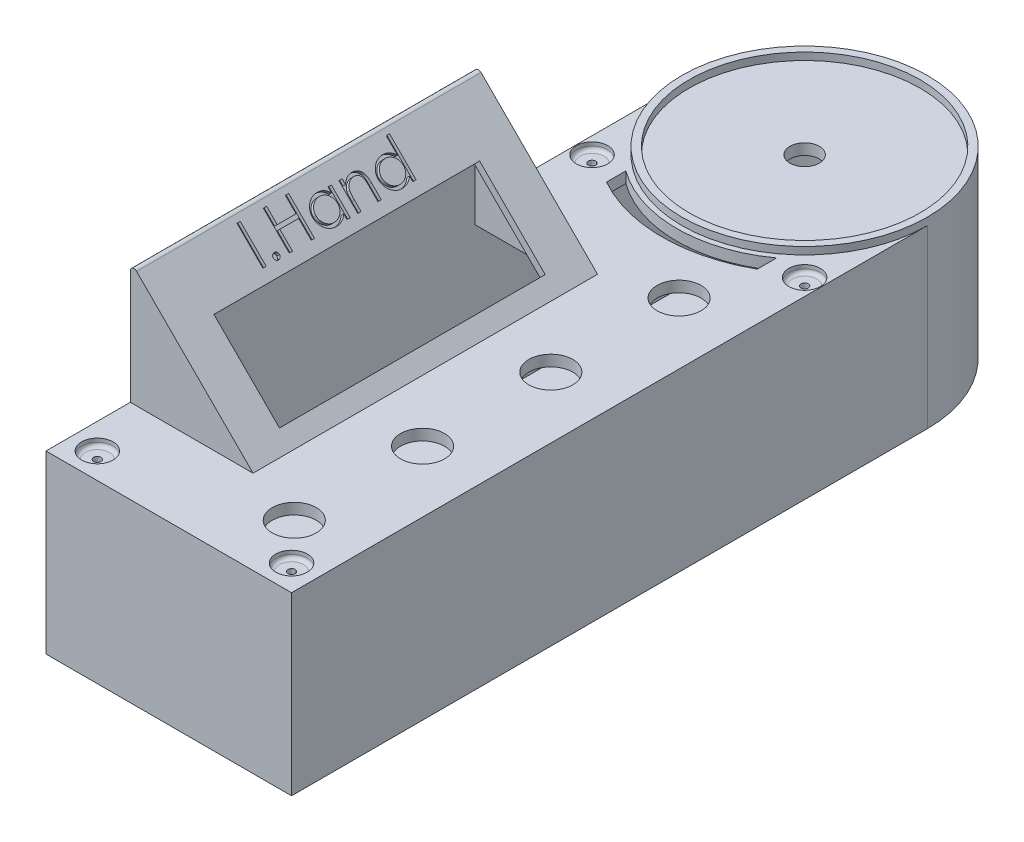
from build123d import *

# Parameters (mm, degrees)
SKETCH4_W                = 63
SKETCH4_H                = 43
BOSS_EXTRUDE2_DEPTH      = 173.5
SKETCH6_R                = 4
CUT_EXTRUDE1_DEPTH       = 3
SKETCH9_W                = 63
SKETCH9_H                = 43
CUT_EXTRUDE2_DEPTH       = 173.5
SKETCH10_R               = 8.2
BOSS_EXTRUDE3_DEPTH      = 22.8
SKETCH11_W               = 63
SKETCH11_H               = 43
BOSS_EXTRUDE4_DEPTH      = 2
SKETCH13_R               = 3
BOSS_EXTRUDE5_DEPTH      = 43
SKETCH14_R               = 1
CUT_EXTRUDE3_DEPTH       = 46
SKETCH15_R               = 4.3
CUT_EXTRUDE4_DEPTH       = 2
FILLET1_R                = 1
SKETCH19_R               = 6
CUT_EXTRUDE5_DEPTH       = 3
BOSS_EXTRUDE6_DEPTH      = 94
SKETCH21_W               = 26.671572875
SKETCH21_H               = 94
CUT_EXTRUDE6_DEPTH       = 13
FILLET2_R                = 1
BOSS_EXTRUDE8_DEPTH      = 2
SKETCH23_W               = 72.5
SKETCH23_H               = 25.3
CUT_EXTRUDE7_DEPTH       = 2
BOSS_EXTRUDE9_START      = -2
BOSS_EXTRUDE9_DEPTH      = 2
SKETCH25_R               = 3
BOSS_EXTRUDE10_DEPTH     = 48
SKETCH26_R               = 1
CUT_EXTRUDE8_DEPTH       = 46
SKETCH27_R               = 4.3
CUT_EXTRUDE9_DEPTH       = 2
FILLET3_R                = 1
SKETCH30_W               = 56
SKETCH30_H               = 18
CUT_EXTRUDE10_DEPTH      = 2
SKETCH31_W               = 60
SKETCH31_H               = 22
SKETCH31_W_2             = 56
SKETCH31_H_2             = 18
BOSS_EXTRUDE11_DEPTH     = 12
FILLET4_R                = 1
SKETCH33_W               = 56
SKETCH33_H               = 18
BOSS_EXTRUDE12_DEPTH     = 2
SKETCH34_W               = 0.897435897
SKETCH34_H               = 10
CUT_EXTRUDE11_DEPTH      = 1
SKETCH35_W               = 13.1
SKETCH35_H               = 12
SKETCH35_W_2             = 9.9
SKETCH35_H_2             = 11.8
CUT_EXTRUDE12_DEPTH      = 2
FILLET5_R                = 1
CUT_EXTRUDE13_DEPTH      = 186.67848556
CUT_EXTRUDE13_DEPTH_BACK = 3
FILLET6_R                = 1
SKETCH37_W               = 140.841687605
SKETCH37_H               = 2
BOSS_EXTRUDE13_DEPTH     = 4
FILLET8_R                = 2


with BuildPart() as part:
    # Sketch1 → Revolve1 (revolve)
    with BuildSketch(Plane.XY, mode=Mode.PRIVATE) as revolve1_sk:
        Polygon((-31.5, 48), (-31.5, 50), (-33.5, 50), (-33.5, 0), (0, 0), (0, 24.8), (-8.2, 24.8), (-8.2, 2), (-31.5, 2), (-31.5, 45), (-4, 45), (-4, 48), align=None)
    revolve(revolve1_sk.sketch.rotate(Axis((0, 0, 0), (0, 1, 0)), 270), axis=Axis((0, 0, 0), (0, 1, 0)))

    # Sketch4 → Boss-Extrude2 (add)
    with BuildSketch(Plane.XY):
        Polygon((33.5, 0), (-33.5, 0), (-33.5, 48), (-31.5, 48), (31.5, 48), (33.5, 48), align=None)
        with Locations((0, 23.5)):
            Rectangle(SKETCH4_W, SKETCH4_H, mode=Mode.SUBTRACT)
    extrude(amount=BOSS_EXTRUDE2_DEPTH)

    # Sketch6 → Cut-Extrude1 (cut)
    with BuildSketch(Plane(origin=(0, 48, 0), x_dir=(1, 0, 0), z_dir=(0, 1, 0))):
        with Locations(Location((0, 0, 0), (0, 0, 90))):
            Circle(SKETCH6_R)
    extrude(amount=-CUT_EXTRUDE1_DEPTH, mode=Mode.SUBTRACT)

    # Sketch9 → Cut-Extrude2 (cut)
    with BuildSketch(Plane.XY.offset(173.5)):
        with Locations((0, 23.5)):
            Rectangle(SKETCH9_W, SKETCH9_H)
    extrude(amount=-CUT_EXTRUDE2_DEPTH, mode=Mode.SUBTRACT)

    # Sketch10 → Boss-Extrude3 (add)
    with BuildSketch(Plane(origin=(0, 2, 0), x_dir=(1, 0, 0), z_dir=(0, 1, 0))):
        with Locations(Location((0, 0, 0), (0, 0, 90))):
            Circle(SKETCH10_R)
    extrude(amount=BOSS_EXTRUDE3_DEPTH)

    # Sketch11 → Boss-Extrude4 (add)
    with BuildSketch(Plane.XY.offset(173.5)):
        with Locations((0, 23.5)):
            Rectangle(SKETCH11_W, SKETCH11_H)
    extrude(amount=-BOSS_EXTRUDE4_DEPTH)

    # Sketch13 → Boss-Extrude5 (add)
    with BuildSketch(Plane(origin=(0, 2, 0), x_dir=(1, 0, 0), z_dir=(0, 1, 0))):
        with Locations(Location((-26.5, -166.5, 0), (0, 0, 90))):
            Circle(SKETCH13_R)
        with Locations(Location((26.5, -166.5, 0), (0, 0, 90))):
            Circle(SKETCH13_R)
    extrude(amount=BOSS_EXTRUDE5_DEPTH)

    # Sketch14 → Cut-Extrude3 (cut)
    with BuildSketch(Plane(origin=(0, 2, 0), x_dir=(1, 0, 0), z_dir=(0, 1, 0))):
        with Locations(Location((-26.5, -166.5, 0), (0, 0, 270))):
            Circle(SKETCH14_R)
        with Locations(Location((26.5, -166.5, 0), (0, 0, 270))):
            Circle(SKETCH14_R)
    extrude(amount=CUT_EXTRUDE3_DEPTH, mode=Mode.SUBTRACT)

    # Sketch15 → Cut-Extrude4 (cut)
    with BuildSketch(Plane(origin=(0, 48, 0), x_dir=(1, 0, 0), z_dir=(0, 1, 0))):
        with Locations(Location((-26.5, -166.5, 0), (0, 0, 270))):
            Circle(SKETCH15_R)
        with Locations(Location((26.5, -166.5, 0), (0, 0, 270))):
            Circle(SKETCH15_R)
    extrude(amount=-CUT_EXTRUDE4_DEPTH, mode=Mode.SUBTRACT)

    # Fillet1
    fillet1_edges = [part.edges().sort_by_distance(p)[0] for p in [
        (-26.5, 46, 162.2),
        (26.5, 46, 162.2),
    ]]
    fillet(fillet1_edges, radius=FILLET1_R)

    # Sketch19 → Cut-Extrude5 (cut)
    with BuildSketch(Plane(origin=(0, 48, 0), x_dir=(1, 0, 0), z_dir=(0, 1, 0))):
        with Locations(Location((16.75, -51, 0), (0, 0, 270))):
            Circle(SKETCH19_R)
        with Locations(Location((16.75, -86, 0), (0, 0, 270))):
            Circle(SKETCH19_R)
        with Locations(Location((16.75, -121, 0), (0, 0, 270))):
            Circle(SKETCH19_R)
        with Locations(Location((16.75, -156, 0), (0, 0, 270))):
            Circle(SKETCH19_R)
    extrude(amount=-CUT_EXTRUDE5_DEPTH, mode=Mode.SUBTRACT)

    # Sketch20 → Boss-Extrude6 (add)
    with BuildSketch(Plane.XY.offset(56.5)):
        Polygon((0, 48), (-33.5, 81.5), (-33.5, 48), align=None)
        Polygon((-4.828427125, 50), (-31.5, 76.671572875), (-31.5, 50), align=None, mode=Mode.SUBTRACT)
    extrude(amount=BOSS_EXTRUDE6_DEPTH)

    # Sketch21 → Cut-Extrude6 (cut)
    with BuildSketch(Plane(origin=(0, 50, 0), x_dir=(1, 0, 0), z_dir=(0, 1, 0))):
        with Locations((-18.164213563, -103.5)):
            Rectangle(SKETCH21_W, SKETCH21_H)
    extrude(amount=-CUT_EXTRUDE6_DEPTH, mode=Mode.SUBTRACT)

    # Fillet2
    fillet2_edges = [part.edges().sort_by_distance(p)[0] for p in [
        (-33.5, 81.5, 103.5),
        (-31.5, 76.671572875, 103.5),
    ]]
    fillet(fillet2_edges, radius=FILLET2_R)

    # Sketch22 → Boss-Extrude8 (add)
    with BuildSketch(Plane.XY.offset(150.5)):
        with BuildLine():
            Line((-33.5, 48), (-33.5, 46))
            Line((-33.5, 46), (0, 46))
            Line((0, 46), (0, 48))
            Line((0, 48), (-31.792893219, 79.792893219))
            ThreePointArc((-31.792893219, 79.792893219), (-32.882683432, 80.00966597), (-33.5, 79.085786438))
            Line((-33.5, 79.085786438), (-33.5, 48))
        make_face()
    extrude(amount=-BOSS_EXTRUDE8_DEPTH)

    # Sketch23 → Cut-Extrude7 (cut)
    with BuildSketch(Plane(origin=(24, 24, 0), x_dir=(0, 0, -1), z_dir=(0.7071067811865437, 0.7071067811865515, 0))):
        with Locations((-103.5, 51.591125497)):
            Rectangle(SKETCH23_W, SKETCH23_H)
    extrude(amount=-CUT_EXTRUDE7_DEPTH, mode=Mode.SUBTRACT)

    # Sketch24 → Boss-Extrude9 (add)
    with BuildSketch(Plane(origin=(0, 0, 56.5), x_dir=(-1, 0, 0), z_dir=(0, 0, -1)).offset(BOSS_EXTRUDE9_START)):
        with BuildLine():
            Line((4.828427125, 45), (4.828427125, 48))
            Line((4.828427125, 48), (4.828427125, 50))
            Line((4.828427125, 50), (29.792893219, 74.964466094))
            ThreePointArc((29.792893219, 74.964466094), (30.882683432, 75.181238845), (31.5, 74.257359313))
            Line((31.5, 74.257359313), (31.5, 48))
            Line((31.5, 48), (31.5, 45))
            Line((31.5, 45), (4.828427125, 45))
        make_face()
    extrude(amount=BOSS_EXTRUDE9_DEPTH)

    # Sketch25 → Boss-Extrude10 (add)
    with BuildSketch(Plane(origin=(0, 48, 0), x_dir=(1, 0, 0), z_dir=(0, 1, 0))):
        with Locations((29, -29)):
            Circle(SKETCH25_R)
        with Locations((-29, -29)):
            Circle(SKETCH25_R)
    extrude(amount=-BOSS_EXTRUDE10_DEPTH)

    # Sketch26 → Cut-Extrude8 (cut)
    with BuildSketch(Plane(origin=(0, 48, 0), x_dir=(1, 0, 0), z_dir=(0, 1, 0))):
        with Locations(Location((29, -29, 0), (0, 0, 270))):
            Circle(SKETCH26_R)
        with Locations(Location((-29, -29, 0), (0, 0, 270))):
            Circle(SKETCH26_R)
    extrude(amount=-CUT_EXTRUDE8_DEPTH, mode=Mode.SUBTRACT)

    # Sketch27 → Cut-Extrude9 (cut)
    with BuildSketch(Plane(origin=(0, 48, 0), x_dir=(1, 0, 0), z_dir=(0, 1, 0))):
        with Locations(Location((-29, -29, 0), (0, 0, 270))):
            Circle(SKETCH27_R)
        with Locations(Location((29, -29, 0), (0, 0, 270))):
            Circle(SKETCH27_R)
    extrude(amount=-CUT_EXTRUDE9_DEPTH, mode=Mode.SUBTRACT)

    # Fillet3
    fillet3_edges = [part.edges().sort_by_distance(p)[0] for p in [
        (-29, 46, 24.7),
        (29, 46, 24.7),
    ]]
    fillet(fillet3_edges, radius=FILLET3_R)

    # Sketch30 → Cut-Extrude10 (cut)
    with BuildSketch(Plane.ZY.offset(33.5)):
        with Locations((103.5, 11)):
            Rectangle(SKETCH30_W, SKETCH30_H)
    extrude(amount=-CUT_EXTRUDE10_DEPTH, mode=Mode.SUBTRACT)

    # Sketch31 → Boss-Extrude11 (add)
    with BuildSketch(Plane.ZY.offset(33.5)):
        with Locations((103.5, 11)):
            Rectangle(SKETCH31_W, SKETCH31_H)
        with Locations((103.5, 11)):
            Rectangle(SKETCH31_W_2, SKETCH31_H_2, mode=Mode.SUBTRACT)
    extrude(amount=BOSS_EXTRUDE11_DEPTH)

    # Fillet4
    fillet4_edges = [part.edges().sort_by_distance(p)[0] for p in [
        (-33.5, 22, 103.5),
        (-33.5, 11, 73.5),
        (-33.5, 11, 133.5),
    ]]
    fillet(fillet4_edges, radius=FILLET4_R)

    # Sketch33 → Boss-Extrude12 (add)
    with BuildSketch(Plane.ZY.offset(45.5)):
        with Locations((103.5, 11)):
            Rectangle(SKETCH33_W, SKETCH33_H)
    extrude(amount=-BOSS_EXTRUDE12_DEPTH)

    # Sketch34 → Cut-Extrude11 (cut)
    # profile 1 of 6: a face of its own
    with BuildSketch(Plane(origin=(24, 24, 0), x_dir=(0, 0, -1), z_dir=(0.7071067811865437, 0.7071067811865515, 0))):
        with Locations((-123.82051282, 72.241125497)):
            Rectangle(SKETCH34_W, SKETCH34_H)
    # profile 2 of 6: a face of its own
    with BuildSketch(Plane(origin=(24, 24, 0), x_dir=(0, 0, -1), z_dir=(0.7071067811865437, 0.7071067811865515, 0))):
        with BuildLine():
            add(Edge.make_bspline(
                [(-120.102564103, 68.779587035), (-120.046877782, 68.776277988), (-119.937711261, 68.769790987), (-119.77988518, 68.725286204), (-119.637043295, 68.64626146), (-119.50980831, 68.540939236), (-119.404932663, 68.413237342), (-119.323091657, 68.271534745), (-119.278974556, 68.112387338), (-119.272534808, 68.002588267), (-119.269230769, 67.946253702)],
                knots=[0, 0, 0, 0, 1.020151414, 1.999887582, 2.974338812, 3.990962822, 5.007586832, 5.987933904, 6.967670073, 8, 8, 8, 8], degree=3))
            add(Edge.make_bspline(
                [(-119.269230769, 67.946253702), (-119.272646771, 67.89127276), (-119.279383077, 67.782851149), (-119.322990529, 67.624904113), (-119.405556387, 67.483112958), (-119.509084938, 67.353678277), (-119.637074748, 67.248132933), (-119.780222881, 67.169780519), (-119.937340761, 67.122089148), (-120.046815971, 67.116014013), (-120.102564103, 67.112920369)],
                knots=[0, 0, 0, 0, 1.009421747, 1.99056486, 2.972319754, 3.999869655, 5.017953583, 5.993804169, 6.978383603, 8, 8, 8, 8], degree=3))
            add(Edge.make_bspline(
                [(-120.102564103, 67.112920369), (-120.158352404, 67.115902075), (-120.267265783, 67.121723147), (-120.423797195, 67.170759736), (-120.567817106, 67.247398194), (-120.695781996, 67.353875078), (-120.800177629, 67.482446916), (-120.879107295, 67.62588062), (-120.92650772, 67.782399013), (-120.932741642, 67.891183707), (-120.935897436, 67.946253702)],
                knots=[0, 0, 0, 0, 1.022052826, 1.995314843, 2.982371812, 4.00089066, 5.028879526, 6.005146991, 6.990147033, 8, 8, 8, 8], degree=3))
            add(Edge.make_bspline(
                [(-120.935897436, 67.946253702), (-120.932862867, 68.002680501), (-120.926938242, 68.112846901), (-120.879007785, 68.270558637), (-120.800790036, 68.413897035), (-120.695060336, 68.540744406), (-120.567848062, 68.646993843), (-120.424144619, 68.724321823), (-120.26688879, 68.770151572), (-120.158288966, 68.776387334), (-120.102564103, 68.779587035)],
                knots=[0, 0, 0, 0, 1.032775665, 2.016367738, 2.991239715, 4.008302682, 5.025365648, 6.011011707, 6.979408107, 8, 8, 8, 8], degree=3))
        make_face()
    # profile 3 of 6: a face of its own
    with BuildSketch(Plane(origin=(24, 24, 0), x_dir=(0, 0, -1), z_dir=(0.7071067811865437, 0.7071067811865515, 0))):
        Polygon((-117.08974359, 77.241125497), (-116.192307692, 77.241125497), (-116.192307692, 73.138561394), (-111.064102564, 73.138561394), (-111.064102564, 77.241125497), (-110.166666667, 77.241125497), (-110.166666667, 67.241125497), (-111.064102564, 67.241125497), (-111.064102564, 72.112920369), (-116.192307692, 72.112920369), (-116.192307692, 67.241125497), (-117.08974359, 67.241125497), align=None)
    # profile 4 of 6: a face of its own
    with BuildSketch(Plane(origin=(24, 24, 0), x_dir=(0, 0, -1), z_dir=(0.7071067811865437, 0.7071067811865515, 0))):
        with BuildLine():
            Line((-100.423076923, 74.548817805), (-100.423076923, 67.241125497))
            Line((-100.423076923, 67.241125497), (-101.320512821, 67.241125497))
            Line((-101.320512821, 67.241125497), (-101.320512821, 68.505147933))
            add(Edge.make_bspline(
                [(-101.320512821, 68.505147933), (-101.421709365, 68.390749093), (-101.619195695, 68.167498318), (-101.94902746, 67.875834968), (-102.298650826, 67.63475405), (-102.666368886, 67.440040005), (-103.051849581, 67.293776987), (-103.454238402, 67.189816532), (-103.87369949, 67.122977003), (-104.16013479, 67.116302655), (-104.305288462, 67.112920369)],
                knots=[0, 0, 0, 0, 1.074387032, 2.096679803, 3.090159297, 4.057316773, 5.018401886, 5.985159533, 6.978961417, 8, 8, 8, 8], degree=3))
            add(Edge.make_bspline(
                [(-104.305288462, 67.112920369), (-104.434339758, 67.11642429), (-104.688834629, 67.123334176), (-105.063203421, 67.176940758), (-105.423466991, 67.263028249), (-105.76996577, 67.382745076), (-106.100457614, 67.541547423), (-106.417772176, 67.731665275), (-106.720265582, 67.958067646), (-107.003327122, 68.216890585), (-107.26398998, 68.498019119), (-107.492736473, 68.797863539), (-107.683459558, 69.115127264), (-107.842945503, 69.445793418), (-107.965792202, 69.792407474), (-108.051431157, 70.153770811), (-108.10497529, 70.529456164), (-108.111882321, 70.785283373), (-108.115384615, 70.915003702)],
                knots=[0, 0, 0, 0, 1.033919861, 2.038935746, 3.024066025, 3.998881131, 4.97069526, 5.957263378, 6.95902576, 7.993208707, 9.027059324, 10.027763471, 11.009749337, 11.988697705, 12.965288445, 13.950418724, 14.960734635, 16, 16, 16, 16], degree=3))
            add(Edge.make_bspline(
                [(-108.115384615, 70.915003702), (-108.111804697, 71.042042855), (-108.104727392, 71.293192407), (-108.052003907, 71.662560116), (-107.963343882, 72.018326575), (-107.83892146, 72.359346413), (-107.679373017, 72.686032271), (-107.485292769, 72.998615199), (-107.256666698, 73.297956335), (-106.993088392, 73.577016983), (-106.707560478, 73.834790166), (-106.402106961, 74.058816011), (-106.084326157, 74.252292722), (-105.749288984, 74.405588368), (-105.401954399, 74.529614381), (-105.039230268, 74.615422861), (-104.662625758, 74.665986636), (-104.406938637, 74.67330882), (-104.27724359, 74.677022933)],
                knots=[0, 0, 0, 0, 1.020392517, 2.01726096, 2.990465484, 3.961182959, 4.928053699, 5.906110375, 6.912531644, 7.948652711, 8.985773172, 9.998621852, 10.987621588, 11.969261332, 12.953316658, 13.946091881, 14.958173133, 16, 16, 16, 16], degree=3))
            add(Edge.make_bspline(
                [(-104.27724359, 74.677022933), (-104.128101135, 74.672915071), (-103.835639821, 74.664859749), (-103.407845509, 74.597823385), (-103.003147001, 74.484570622), (-102.61842028, 74.330520627), (-102.255046892, 74.125809973), (-101.916466936, 73.867581513), (-101.599136984, 73.557463836), (-101.415193294, 73.319262566), (-101.320512821, 73.196654343)],
                knots=[0, 0, 0, 0, 1.038897134, 2.037228247, 3.008116434, 3.962042015, 4.918381754, 5.904844433, 6.921570401, 8, 8, 8, 8], degree=3))
            Line((-101.320512821, 73.196654343), (-101.320512821, 74.548817805))
            Line((-101.320512821, 74.548817805), (-100.423076923, 74.548817805))
        make_face()
        with BuildLine():
            add(Edge.make_bspline(
                [(-104.265224359, 73.779587035), (-104.396408181, 73.774919499), (-104.655344181, 73.765706525), (-105.035469902, 73.693782253), (-105.399222513, 73.574111983), (-105.744782725, 73.410449408), (-106.066691916, 73.204653018), (-106.354388118, 72.95573478), (-106.610224408, 72.670486168), (-106.825390877, 72.350194424), (-107.000792297, 72.00682845), (-107.124126674, 71.647901484), (-107.205467381, 71.279887262), (-107.213777439, 71.030279588), (-107.217948718, 70.904987676)],
                knots=[0, 0, 0, 0, 1.031046209, 2.035121221, 3.029706178, 4.034933723, 5.034054252, 6.02443088, 7.017295772, 8.038157696, 9.050218397, 10.03989886, 11.016116709, 12, 12, 12, 12], degree=3))
            add(Edge.make_bspline(
                [(-107.217948718, 70.904987676), (-107.212620451, 70.780444513), (-107.201984803, 70.531846353), (-107.125554248, 70.16333042), (-106.997326038, 69.804318871), (-106.822348716, 69.45785889), (-106.603244074, 69.136190031), (-106.349276495, 68.845503967), (-106.057989977, 68.595533715), (-105.735339957, 68.386283504), (-105.390745756, 68.21724773), (-105.028363094, 68.099631618), (-104.655004128, 68.023695102), (-104.401140317, 68.014825168), (-104.273237179, 68.010356266)],
                knots=[0, 0, 0, 0, 0.979072187, 1.954306742, 2.945804271, 3.96968567, 4.997920485, 5.998718438, 6.996577872, 8.005894225, 9.015743152, 10.005417472, 10.995077863, 12, 12, 12, 12], degree=3))
            add(Edge.make_bspline(
                [(-104.273237179, 68.010356266), (-104.143390029, 68.01509902), (-103.885136924, 68.024531888), (-103.503883473, 68.096764074), (-103.133897865, 68.216103498), (-102.78022007, 68.381529575), (-102.45074541, 68.586550591), (-102.155037188, 68.826570851), (-101.904991564, 69.105722806), (-101.693012679, 69.412512672), (-101.526797203, 69.748832662), (-101.405722748, 70.10693035), (-101.33414016, 70.486818201), (-101.325118076, 70.746429421), (-101.320512821, 70.87894601)],
                knots=[0, 0, 0, 0, 1.01762866, 2.023962475, 3.030623092, 4.058876274, 5.077231937, 6.066672613, 7.034107872, 8.005628644, 8.981990164, 9.965428785, 10.961468474, 12, 12, 12, 12], degree=3))
            add(Edge.make_bspline(
                [(-101.320512821, 70.87894601), (-101.323254696, 70.97991124), (-101.328651574, 71.178642764), (-101.369881773, 71.470435671), (-101.435467277, 71.749674888), (-101.527884906, 72.016654), (-101.649288575, 72.269896901), (-101.795710764, 72.51122193), (-101.969726334, 72.739373963), (-102.168534037, 72.951211308), (-102.386148902, 73.144429772), (-102.616419018, 73.316899031), (-102.862072581, 73.458581239), (-103.1189784, 73.575842015), (-103.387582213, 73.669153871), (-103.670069698, 73.731404425), (-103.963438232, 73.774148199), (-104.163569819, 73.777755002), (-104.265224359, 73.779587035)],
                knots=[0, 0, 0, 0, 1.050140795, 2.067009409, 3.05949893, 4.030605086, 5.00011959, 5.97591094, 6.962425594, 7.979863591, 8.993523472, 9.986985069, 10.967611495, 11.937549037, 12.921786183, 13.919465291, 14.943216303, 16, 16, 16, 16], degree=3))
        make_face(mode=Mode.SUBTRACT)
    # profile 5 of 6: a face of its own
    with BuildSketch(Plane(origin=(24, 24, 0), x_dir=(0, 0, -1), z_dir=(0.7071067811865437, 0.7071067811865515, 0))):
        with BuildLine():
            Line((-98.371794872, 74.548817805), (-97.474358974, 74.548817805))
            Line((-97.474358974, 74.548817805), (-97.474358974, 73.23070883))
            add(Edge.make_bspline(
                [(-97.474358974, 73.23070883), (-97.37853716, 73.350259467), (-97.192591585, 73.582251648), (-96.882922062, 73.887167576), (-96.555653775, 74.138439647), (-96.212790908, 74.338736201), (-95.853868022, 74.489726562), (-95.481072965, 74.598772079), (-95.092173805, 74.664157304), (-94.827703985, 74.672700819), (-94.693910256, 74.677022933)],
                knots=[0, 0, 0, 0, 1.12780773, 2.188550248, 3.19190651, 4.159438251, 5.104880172, 6.052711206, 7.014878035, 8, 8, 8, 8], degree=3))
            add(Edge.make_bspline(
                [(-94.693910256, 74.677022933), (-94.558679873, 74.67203666), (-94.294001394, 74.662277322), (-93.908635504, 74.585086776), (-93.548711522, 74.45324319), (-93.215512791, 74.272637274), (-92.915149325, 74.04804735), (-92.651364035, 73.786396545), (-92.433183328, 73.485436307), (-92.286905148, 73.20622729), (-92.190546155, 72.95854502), (-92.129882333, 72.746411448), (-92.078365243, 72.510073874), (-92.033703106, 72.250246476), (-92.003482786, 71.96510879), (-91.979647668, 71.65582967), (-91.962565684, 71.322509297), (-91.96188795, 71.091976076), (-91.961538462, 70.973096651)],
                knots=[0, 0, 0, 0, 1.235846778, 2.418850247, 3.575807741, 4.728682307, 5.871620074, 6.994088408, 8.11269785, 9.256955736, 9.865816715, 10.540099792, 11.271859618, 12.076849838, 12.949306005, 13.892391288, 14.913166135, 16, 16, 16, 16], degree=3))
            Line((-91.961538462, 70.973096651), (-91.961538462, 67.241125497))
            Line((-91.961538462, 67.241125497), (-92.858974359, 67.241125497))
            Line((-92.858974359, 67.241125497), (-92.858974359, 70.678625497))
            add(Edge.make_bspline(
                [(-92.858974359, 70.678625497), (-92.859526382, 70.778118197), (-92.860582308, 70.968430799), (-92.863912727, 71.240913722), (-92.871940746, 71.488018232), (-92.88322164, 71.709153568), (-92.899733156, 71.904107386), (-92.916940674, 72.073276748), (-92.937983465, 72.21644687), (-92.956734645, 72.302632819), (-92.965144231, 72.341285753)],
                knots=[0, 0, 0, 0, 1.430800155, 2.736877192, 3.918605307, 4.986035426, 5.920637409, 6.731861385, 7.431261377, 8, 8, 8, 8], degree=3))
            add(Edge.make_bspline(
                [(-92.965144231, 72.341285753), (-92.995502892, 72.454746282), (-93.053933923, 72.673122695), (-93.198316732, 72.969335131), (-93.380642962, 73.221329953), (-93.603208246, 73.427549158), (-93.863862748, 73.588037263), (-94.161883156, 73.699391419), (-94.494393558, 73.769037903), (-94.728263223, 73.775972566), (-94.850160256, 73.779587035)],
                knots=[0, 0, 0, 0, 1.084156227, 2.086665306, 3.027808233, 3.945421172, 4.874247719, 5.839848303, 6.874090471, 8, 8, 8, 8], degree=3))
            add(Edge.make_bspline(
                [(-94.850160256, 73.779587035), (-94.922353638, 73.778227022), (-95.065222475, 73.775535591), (-95.277079538, 73.748531882), (-95.482577176, 73.704364866), (-95.683777773, 73.644740188), (-95.876657183, 73.56284799), (-96.067412301, 73.469906932), (-96.248860198, 73.354054898), (-96.424869905, 73.224938837), (-96.588620784, 73.081855387), (-96.740987465, 72.930871073), (-96.87681038, 72.770083633), (-96.999863738, 72.602083783), (-97.106087347, 72.424564246), (-97.198810456, 72.239237656), (-97.27748387, 72.045860088), (-97.316577277, 71.911645627), (-97.336137821, 71.844490882)],
                knots=[0, 0, 0, 0, 1.023777757, 2.026029729, 3.023749952, 4.003683103, 4.997618607, 5.993177895, 7.010360494, 8.046726602, 9.087585522, 10.09234134, 11.086953743, 12.070360549, 13.043493632, 14.017870808, 15.008233677, 16, 16, 16, 16], degree=3))
            add(Edge.make_bspline(
                [(-97.336137821, 71.844490882), (-97.347393959, 71.795190301), (-97.371897985, 71.687865517), (-97.398364213, 71.511738605), (-97.422385857, 71.307995819), (-97.442491453, 71.076874913), (-97.454792643, 70.817566699), (-97.468205205, 70.531178591), (-97.473088237, 70.216568624), (-97.473923534, 69.997535216), (-97.474358974, 69.883353061)],
                knots=[0, 0, 0, 0, 0.615963638, 1.340920617, 2.168419149, 3.115676021, 4.16674242, 5.331190069, 6.6087489, 8, 8, 8, 8], degree=3))
            Line((-97.474358974, 69.883353061), (-97.474358974, 67.241125497))
            Line((-97.474358974, 67.241125497), (-98.371794872, 67.241125497))
            Line((-98.371794872, 67.241125497), (-98.371794872, 74.548817805))
        make_face()
    # profile 6 of 6: a face of its own
    with BuildSketch(Plane(origin=(24, 24, 0), x_dir=(0, 0, -1), z_dir=(0.7071067811865437, 0.7071067811865515, 0))):
        with BuildLine():
            Line((-82.474358974, 77.497535753), (-82.474358974, 67.241125497))
            Line((-82.474358974, 67.241125497), (-83.371794872, 67.241125497))
            Line((-83.371794872, 67.241125497), (-83.371794872, 68.505147933))
            add(Edge.make_bspline(
                [(-83.371794872, 68.505147933), (-83.472991416, 68.390749093), (-83.670477746, 68.167498318), (-84.000309511, 67.875834968), (-84.349932877, 67.63475405), (-84.717650937, 67.440040005), (-85.103131633, 67.293776987), (-85.505520453, 67.189816532), (-85.924981542, 67.122977003), (-86.211416841, 67.116302655), (-86.356570513, 67.112920369)],
                knots=[0, 0, 0, 0, 1.074387032, 2.096679803, 3.090159297, 4.057316773, 5.018401886, 5.985159533, 6.978961417, 8, 8, 8, 8], degree=3))
            add(Edge.make_bspline(
                [(-86.356570513, 67.112920369), (-86.485621809, 67.11642429), (-86.740116681, 67.123334176), (-87.114485472, 67.176940758), (-87.474749042, 67.263028249), (-87.821247821, 67.382745076), (-88.151739665, 67.541547423), (-88.469054227, 67.731665275), (-88.771547633, 67.958067646), (-89.054609173, 68.216890585), (-89.315272031, 68.498019119), (-89.544018524, 68.797863539), (-89.73474161, 69.115127264), (-89.894227555, 69.445793418), (-90.017074253, 69.792407474), (-90.102713208, 70.153770811), (-90.156257341, 70.529456164), (-90.163164372, 70.785283373), (-90.166666667, 70.915003702)],
                knots=[0, 0, 0, 0, 1.033919861, 2.038935746, 3.024066025, 3.998881131, 4.97069526, 5.957263378, 6.95902576, 7.993208707, 9.027059324, 10.027763471, 11.009749337, 11.988697705, 12.965288445, 13.950418724, 14.960734635, 16, 16, 16, 16], degree=3))
            add(Edge.make_bspline(
                [(-90.166666667, 70.915003702), (-90.163086748, 71.042042855), (-90.156009443, 71.293192407), (-90.103285958, 71.662560116), (-90.014625933, 72.018326575), (-89.890203511, 72.359346413), (-89.730655069, 72.686032271), (-89.53657482, 72.998615199), (-89.307948749, 73.297956335), (-89.044370444, 73.577016983), (-88.758842529, 73.834790166), (-88.453389012, 74.058816011), (-88.135608208, 74.252292722), (-87.800571035, 74.405588368), (-87.45323645, 74.529614381), (-87.090512319, 74.615422861), (-86.713907809, 74.665986636), (-86.458220689, 74.67330882), (-86.328525641, 74.677022933)],
                knots=[0, 0, 0, 0, 1.020392517, 2.01726096, 2.990465484, 3.961182959, 4.928053699, 5.906110375, 6.912531644, 7.948652711, 8.985773172, 9.998621852, 10.987621588, 11.969261332, 12.953316658, 13.946091881, 14.958173133, 16, 16, 16, 16], degree=3))
            add(Edge.make_bspline(
                [(-86.328525641, 74.677022933), (-86.179334762, 74.672545516), (-85.886489646, 74.663756843), (-85.458208156, 74.59031008), (-85.053100697, 74.466987572), (-84.668835018, 74.29815534), (-84.307701989, 74.078724622), (-83.967054445, 73.813720485), (-83.652816379, 73.495642925), (-83.466896886, 73.256752715), (-83.371794872, 73.134554984)],
                knots=[0, 0, 0, 0, 1.031072012, 2.023879775, 2.993683497, 3.952812103, 4.918022106, 5.908088563, 6.929940113, 8, 8, 8, 8], degree=3))
            Line((-83.371794872, 73.134554984), (-83.371794872, 77.497535753))
            Line((-83.371794872, 77.497535753), (-82.474358974, 77.497535753))
        make_face()
        with BuildLine():
            add(Edge.make_bspline(
                [(-86.31650641, 73.779587035), (-86.447690233, 73.774919499), (-86.706626233, 73.765706525), (-87.086751953, 73.693782253), (-87.450504565, 73.574111983), (-87.796064777, 73.410449408), (-88.117973967, 73.204653018), (-88.405670169, 72.95573478), (-88.661506459, 72.670486168), (-88.876672928, 72.350194424), (-89.052074348, 72.00682845), (-89.175408725, 71.647901484), (-89.256749432, 71.279887262), (-89.265059491, 71.030279588), (-89.269230769, 70.904987676)],
                knots=[0, 0, 0, 0, 1.031046209, 2.035121221, 3.029706178, 4.034933723, 5.034054252, 6.02443088, 7.017295772, 8.038157696, 9.050218397, 10.03989886, 11.016116709, 12, 12, 12, 12], degree=3))
            add(Edge.make_bspline(
                [(-89.269230769, 70.904987676), (-89.263902503, 70.780444513), (-89.253266854, 70.531846353), (-89.176836299, 70.16333042), (-89.048608089, 69.804318871), (-88.873630767, 69.45785889), (-88.654526125, 69.136190031), (-88.400558546, 68.845503967), (-88.109272028, 68.595533715), (-87.786622008, 68.386283504), (-87.442027807, 68.21724773), (-87.079645146, 68.099631618), (-86.706286179, 68.023695102), (-86.452422368, 68.014825168), (-86.324519231, 68.010356266)],
                knots=[0, 0, 0, 0, 0.979072187, 1.954306742, 2.945804271, 3.96968567, 4.997920485, 5.998718438, 6.996577872, 8.005894225, 9.015743152, 10.005417472, 10.995077863, 12, 12, 12, 12], degree=3))
            add(Edge.make_bspline(
                [(-86.324519231, 68.010356266), (-86.19467208, 68.01509902), (-85.936418976, 68.024531888), (-85.555165525, 68.096764074), (-85.185179917, 68.216103498), (-84.831502121, 68.381529575), (-84.502027461, 68.586550591), (-84.206319239, 68.826570851), (-83.956273615, 69.105722806), (-83.744294731, 69.412512672), (-83.578079254, 69.748832662), (-83.457004799, 70.10693035), (-83.385422212, 70.486818201), (-83.376400127, 70.746429421), (-83.371794872, 70.87894601)],
                knots=[0, 0, 0, 0, 1.01762866, 2.023962475, 3.030623092, 4.058876274, 5.077231937, 6.066672613, 7.034107872, 8.005628644, 8.981990164, 9.965428785, 10.961468474, 12, 12, 12, 12], degree=3))
            add(Edge.make_bspline(
                [(-83.371794872, 70.87894601), (-83.374536747, 70.97991124), (-83.379933626, 71.178642764), (-83.421163824, 71.470435671), (-83.486749328, 71.749674888), (-83.579166957, 72.016654), (-83.700570627, 72.269896901), (-83.846992815, 72.51122193), (-84.021008385, 72.739373963), (-84.219816089, 72.951211308), (-84.437430953, 73.144429772), (-84.667701069, 73.316899031), (-84.913354632, 73.458581239), (-85.170260452, 73.575842015), (-85.438864264, 73.669153871), (-85.72135175, 73.731404425), (-86.014720284, 73.774148199), (-86.214851871, 73.777755002), (-86.31650641, 73.779587035)],
                knots=[0, 0, 0, 0, 1.050140795, 2.067009409, 3.05949893, 4.030605086, 5.00011959, 5.97591094, 6.962425594, 7.979863591, 8.993523472, 9.986985069, 10.967611495, 11.937549037, 12.921786183, 13.919465291, 14.943216303, 16, 16, 16, 16], degree=3))
        make_face(mode=Mode.SUBTRACT)
    extrude(amount=-CUT_EXTRUDE11_DEPTH, mode=Mode.SUBTRACT)

    # Sketch35 → Cut-Extrude12 (cut)
    with BuildSketch(Plane.ZY.offset(45.5)):
        with Locations((93.15, 13)):
            Rectangle(SKETCH35_W, SKETCH35_H)
        with Locations((124.05, 12.9)):
            Rectangle(SKETCH35_W_2, SKETCH35_H_2)
    extrude(amount=-CUT_EXTRUDE12_DEPTH, mode=Mode.SUBTRACT)

    # Fillet5
    fillet5_edges = [part.edges().sort_by_distance(p)[0] for p in [
        (-45.5, 22, 103.5),
        (-45.5, 11, 73.5),
        (-45.5, 11, 133.5),
    ]]
    fillet(fillet5_edges, radius=FILLET5_R)

    # Sketch36 → Cut-Extrude13 (cut, two sides: drawn at the far end of the back side and taken through both)
    with BuildSketch(Plane(origin=(0, 48, 0), x_dir=(1, 0, 0), z_dir=(0, 1, 0)).offset(-CUT_EXTRUDE13_DEPTH_BACK)):
        with BuildLine():
            Line((0, -34.893159234), (0, -38.893159234))
            ThreePointArc((0, -38.893159234), (10.633828773, -37.522467598), (20.57248383, -33.5))
            Line((20.57248383, -33.5), (20.57248383, -28.208754037))
            ThreePointArc((20.57248383, -28.208754037), (10.815594803, -33.180137304), (0, -34.893159234))
        make_face()
        with BuildLine():
            ThreePointArc((0, -38.893159234), (-10.633828773, -37.522467598), (-20.57248383, -33.5))
            Line((-20.57248383, -33.5), (-20.57248383, -28.208754037))
            ThreePointArc((-20.57248383, -28.208754037), (-10.815594803, -33.180137304), (0, -34.893159234))
            Line((0, -34.893159234), (0, -38.893159234))
        make_face()
    extrude(amount=CUT_EXTRUDE13_DEPTH + CUT_EXTRUDE13_DEPTH_BACK, mode=Mode.SUBTRACT)

    # Fillet6
    fillet6_edges = [part.edges().sort_by_distance(p)[0] for p in [
        (-31.5, 20, 103.5),
        (-31.5, 11, 131.5),
        (-31.5, 11, 75.5),
    ]]
    fillet(fillet6_edges, radius=FILLET6_R)

    # Sketch37 → Boss-Extrude13 (add)
    with BuildSketch(Plane.ZY.offset(-31.5)):
        with Locations((101.079156197, 34.5)):
            Rectangle(SKETCH37_W, SKETCH37_H)
        with Locations((101.079156197, 30.4)):
            Rectangle(SKETCH37_W, SKETCH37_H)
    extrude(amount=BOSS_EXTRUDE13_DEPTH)

    # Fillet8
    fillet8_edges = [part.edges().sort_by_distance(p)[0] for p in [
        (31.5, 29.4, 101.079156198),
    ]]
    fillet(fillet8_edges, radius=FILLET8_R - 0.0001)  # a hair under: the kernel refuses the full size


solid = part.part
